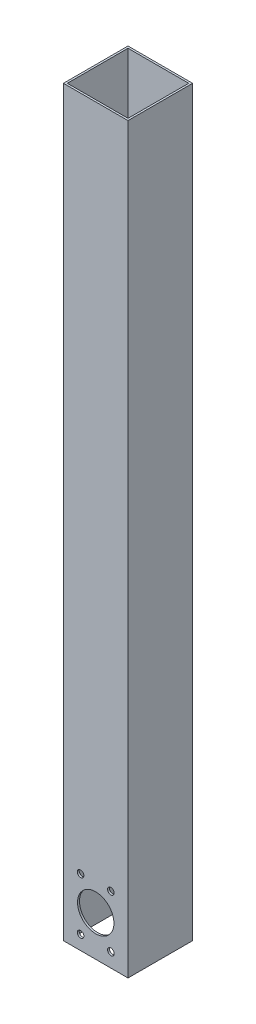
from build123d import *

# Parameters (mm, degrees)
SKETCH1_W               = 50.8
SKETCH1_H               = 50.8
SKETCH1_W_2             = 47.752
SKETCH1_H_2             = 47.752
EXTRUDE_THIN1_DEPTH     = 584.2
CUT_EXTRUDE1_DEPTH      = 586.303305988
CUT_EXTRUDE1_DEPTH_BACK = 586.303305988
SKETCH2_R               = 14.3002
SKETCH2_R_2             = 2.5908


with BuildPart() as part:
    # Sketch1 → Extrude-Thin1 (new body)
    with BuildSketch(Plane(origin=(0, 0, 0), x_dir=(1, 0, 0), z_dir=(0, 1, 0))):
        Rectangle(SKETCH1_W, SKETCH1_H)
        Rectangle(SKETCH1_W_2, SKETCH1_H_2, mode=Mode.SUBTRACT)
    extrude(amount=EXTRUDE_THIN1_DEPTH)

    # Sketch2 → Cut-Extrude1 (cut, two sides: drawn at the far end of the back side and taken through both)
    with BuildSketch(Plane.XY.offset(-CUT_EXTRUDE1_DEPTH_BACK)):
        with Locations((0, 31.75)):
            Circle(SKETCH2_R)
        with Locations((-11.9126, 11.11677155)):
            Circle(SKETCH2_R_2)
        with Locations((11.9126, 11.11677155)):
            Circle(SKETCH2_R_2)
        with Locations((11.9126, 52.38322845)):
            Circle(SKETCH2_R_2)
        with Locations((-11.9126, 52.38322845)):
            Circle(SKETCH2_R_2)
    extrude(amount=CUT_EXTRUDE1_DEPTH + CUT_EXTRUDE1_DEPTH_BACK, mode=Mode.SUBTRACT)


solid = part.part
